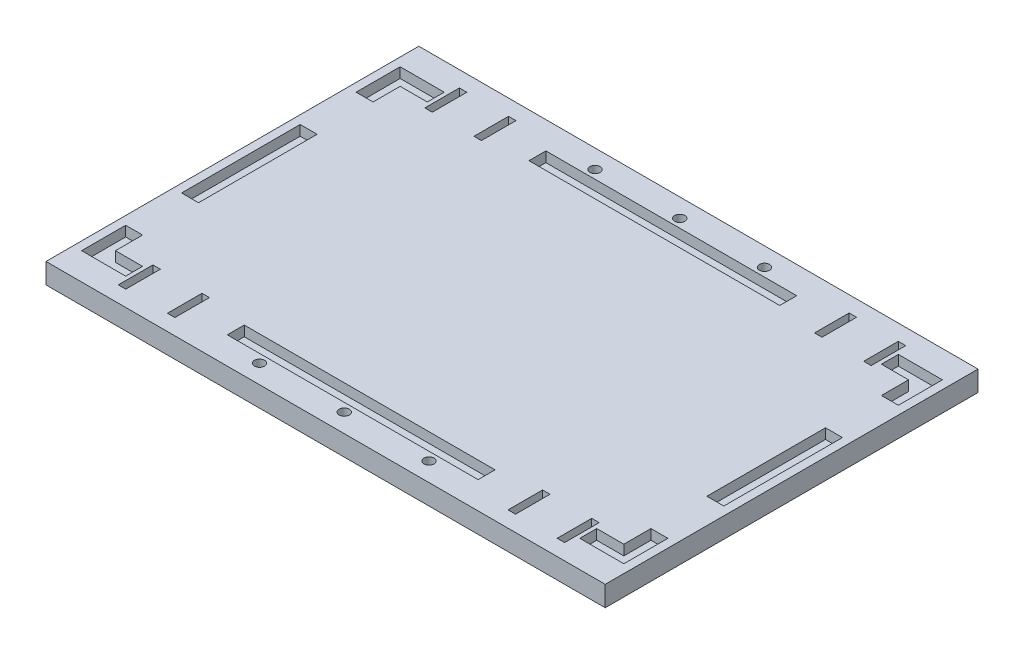
from build123d import *

# Parameters (mm, degrees)
SKETCH1_W           = 165
SKETCH1_H           = 110
BOSS_EXTRUDE1_DEPTH = 6
SKETCH2_W           = 5
SKETCH2_H           = 35
SKETCH2_W_2         = 74
SKETCH2_H_2         = 5
SKETCH2_W_3         = 2.2
SKETCH2_H_3         = 10.2
CUT_EXTRUDE1_DEPTH  = 3
SKETCH3_R           = 1.5
CUT_EXTRUDE2_DEPTH  = 111.956279878


with BuildPart() as part:
    # Sketch1 → Boss-Extrude1 (new body)
    with BuildSketch(Plane(origin=(0, 0, 0), x_dir=(1, 0, 0), z_dir=(0, 1, 0))):
        with Locations((-12.658730159, 1.746031746)):
            Rectangle(SKETCH1_W, SKETCH1_H)
    extrude(amount=BOSS_EXTRUDE1_DEPTH)

    # Sketch2 → Cut-Extrude1 (cut)
    with BuildSketch(Plane(origin=(0, 6, 0), x_dir=(1, 0, 0), z_dir=(0, 1, 0))):
        Polygon((-92.658730159, 48.746031746), (-92.658730159, 35.746031746), (-87.658730159, 35.746031746), (-87.658730159, 43.746031746), (-79.658730159, 43.746031746), (-79.658730159, 48.746031746), align=None)
        Polygon((-79.658730159, -40.253968254), (-79.658730159, -45.253968254), (-92.658730159, -45.253968254), (-92.658730159, -32.253968254), (-87.658730159, -32.253968254), (-87.658730159, -40.253968254), align=None)
        Polygon((54.341269841, 43.746031746), (54.341269841, 48.746031746), (67.341269841, 48.746031746), (67.341269841, 35.746031746), (62.341269841, 35.746031746), (62.341269841, 43.746031746), align=None)
        Polygon((62.341269841, -40.253968254), (54.341269841, -40.253968254), (54.341269841, -45.253968254), (67.341269841, -45.253968254), (67.341269841, -32.253968254), (62.341269841, -32.253968254), align=None)
        with Locations((64.841269841, 1.746031746)):
            Rectangle(SKETCH2_W, SKETCH2_H)
        with Locations((-90.158730159, 1.746031746)):
            Rectangle(SKETCH2_W, SKETCH2_H)
        with Locations((-12.658730159, -42.753968254)):
            Rectangle(SKETCH2_W_2, SKETCH2_H_2)
        with Locations((-12.658730159, 46.246031746)):
            Rectangle(SKETCH2_W_2, SKETCH2_H_2)
        with Locations((-77.408730159, 46.966237914)):
            Rectangle(SKETCH2_W_3, SKETCH2_H_3)
        with Locations((-62.908730159, 46.966237914)):
            Rectangle(SKETCH2_W_3, SKETCH2_H_3)
        with Locations((52.091269841, 46.966237914)):
            Rectangle(SKETCH2_W_3, SKETCH2_H_3)
        with Locations((37.591269841, 46.966237914)):
            Rectangle(SKETCH2_W_3, SKETCH2_H_3)
        with Locations((52.091269841, -43.474174422)):
            Rectangle(SKETCH2_W_3, SKETCH2_H_3)
        with Locations((37.591269841, -43.474174422)):
            Rectangle(SKETCH2_W_3, SKETCH2_H_3)
        with Locations((-62.908730159, -43.474174422)):
            Rectangle(SKETCH2_W_3, SKETCH2_H_3)
        with Locations((-77.408730159, -43.474174422)):
            Rectangle(SKETCH2_W_3, SKETCH2_H_3)
    extrude(amount=-CUT_EXTRUDE1_DEPTH, mode=Mode.SUBTRACT)

    # Sketch3 → Cut-Extrude2 (cut, through all)
    with BuildSketch(Plane(origin=(0, 6, 0), x_dir=(1, 0, 0), z_dir=(0, 1, 0))):
        with Locations((-37.658730159, 51.246031746)):
            Circle(SKETCH3_R)
        with Locations((12.341269841, 51.246031746)):
            Circle(SKETCH3_R)
        with Locations((-12.658730159, 51.246031746)):
            Circle(SKETCH3_R)
        with Locations((12.341269841, -47.753968254)):
            Circle(SKETCH3_R)
        with Locations((-12.658730159, -47.753968254)):
            Circle(SKETCH3_R)
        with Locations((-37.658730159, -47.753968254)):
            Circle(SKETCH3_R)
    extrude(amount=-CUT_EXTRUDE2_DEPTH, mode=Mode.SUBTRACT)


solid = part.part
